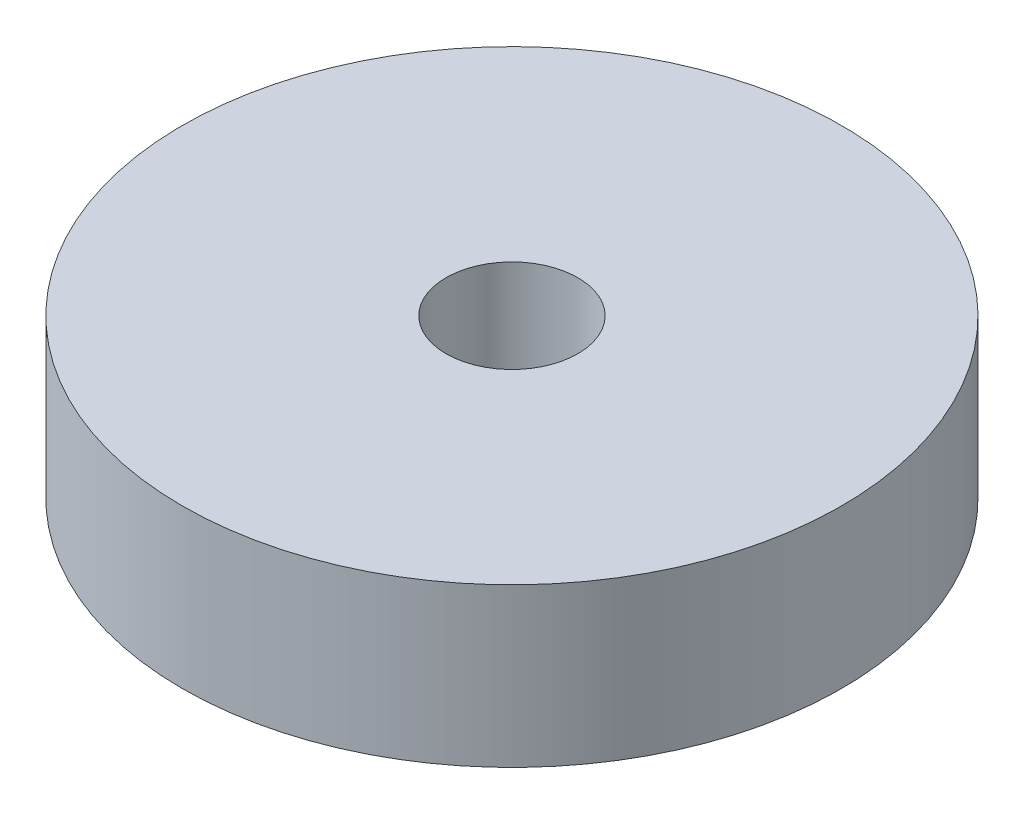
from build123d import *

# Parameters (mm, degrees)
SKETCH1_R           = 37.5
BOSS_EXTRUDE1_DEPTH = 18
SKETCH2_R           = 7.5
CUT_EXTRUDE1_DEPTH  = 57.004464108


with BuildPart() as part:
    # Sketch1 → Boss-Extrude1 (new body)
    with BuildSketch(Plane(origin=(0, 0, 0), x_dir=(1, 0, 0), z_dir=(0, 1, 0))):
        Circle(SKETCH1_R)
    extrude(amount=BOSS_EXTRUDE1_DEPTH)

    # Sketch2 → Cut-Extrude1 (cut, through all)
    with BuildSketch(Plane(origin=(0, 0, 0), x_dir=(1, 0, 0), z_dir=(0, 1, 0))):
        Circle(SKETCH2_R)
    extrude(amount=CUT_EXTRUDE1_DEPTH, mode=Mode.SUBTRACT)


solid = part.part
